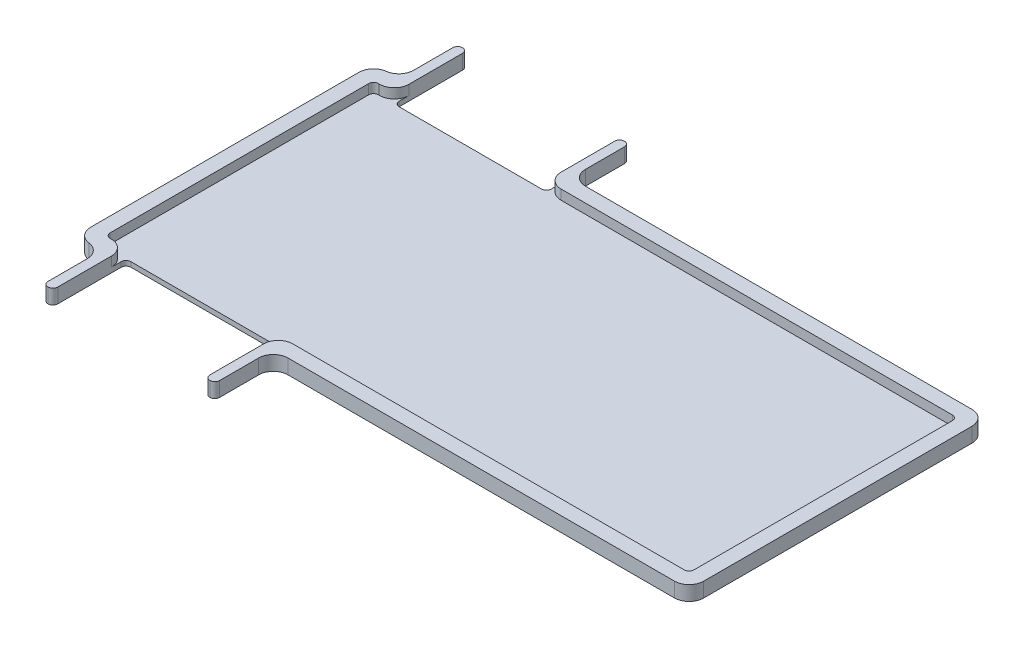
from build123d import *

# Parameters (mm, degrees)
BOSS_EXTRUDE6_DEPTH   = 3
BOSS_EXTRUDE6_2_DEPTH = 3
SKETCH4_W             = 119.7
SKETCH4_H             = 55
BOSS_EXTRUDE7_DEPTH   = 1
FILLET13_R            = 3
FILLET14_R            = 1
FILLET15_R            = 1
FILLET16_R            = 3
FILLET17_R            = 3
FILLET18_R            = 1
FILLET19_R            = 3
FILLET20_R            = 1


with BuildPart() as part:
    # Sketch3 → Boss-Extrude6 (new body)
    with BuildSketch(Plane(origin=(0, 0, 0), x_dir=(1, 0, 0), z_dir=(0, 1, 0))):
        Polygon((-55.6, -27.5), (-59.85, -27.5), (-59.85, 27.5), (-55.6, 27.5), (-55.6, 42.5), (-57.6, 42.5), (-57.6, 30.5), (-62.85, 30.5), (-62.85, -30.5), (-57.6, -30.5), (-57.6, -42.5), (-55.6, -42.5), align=None)
    extrude(amount=BOSS_EXTRUDE6_DEPTH)



with BuildPart() as body_2:
    # Sketch3 → Boss-Extrude6 2 (new body)
    with BuildSketch(Plane(origin=(0, 0, 0), x_dir=(1, 0, 0), z_dir=(0, 1, 0))):
        Polygon((59.85, -27.5), (-24.4, -27.5), (-24.4, -42.5), (-22.4, -42.5), (-22.4, -30.5), (62.85, -30.5), (62.85, 30.5), (-22.4, 30.5), (-22.4, 42.5), (-24.4, 42.5), (-24.4, 27.5), (59.85, 27.5), align=None)
    extrude(amount=BOSS_EXTRUDE6_2_DEPTH)


with BuildPart() as part_1:
    add(part.part)

    add(body_2.part)  # Boss-Extrude7 merges body 2
    # Sketch4 → Boss-Extrude7 (add)
    with BuildSketch(Plane(origin=(0, 0, 0), x_dir=(1, 0, 0), z_dir=(0, 1, 0))):
        Rectangle(SKETCH4_W, SKETCH4_H)
    extrude(amount=BOSS_EXTRUDE7_DEPTH)

    # Fillet13
    fillet13_edges = [part_1.edges().sort_by_distance(p)[0] for p in [
        (-62.85, 1.5, 30.5),
        (-62.85, 1.5, -30.5),
        (62.85, 1.5, 30.5),
        (62.85, 1.5, -30.5),
    ]]
    fillet(fillet13_edges, radius=FILLET13_R)

    # Fillet14
    fillet14_edges = [part_1.edges().sort_by_distance(p)[0] for p in [
        (-59.85, 2, -27.5),
        (-59.85, 2, 27.5),
        (59.85, 2, -27.5),
        (59.85, 2, 27.5),
    ]]
    fillet(fillet14_edges, radius=FILLET14_R)

    # Fillet15
    fillet15_edges = [part_1.edges().sort_by_distance(p)[0] for p in [
        (-22.4, 1.5, 42.5),
        (-24.4, 1.5, 42.5),
        (-55.6, 1.5, 42.5),
        (-57.6, 1.5, 42.5),
        (-55.6, 1.5, -42.5),
        (-57.6, 1.5, -42.5),
        (-22.4, 1.5, -42.5),
        (-24.4, 1.5, -42.5),
    ]]
    fillet(fillet15_edges, radius=FILLET15_R - 0.0001)  # a hair under: the kernel refuses the full size

    # Fillet16
    fillet16_edges = [part_1.edges().sort_by_distance(p)[0] for p in [
        (-22.4, 1.5, -30.5),
        (-57.6, 1.5, -30.5),
        (-57.6, 1.5, 30.5),
        (-22.4, 1.5, 30.5),
    ]]
    fillet(fillet16_edges, radius=FILLET16_R)

    # Fillet17
    fillet17_edges = [part_1.edges().sort_by_distance(p)[0] for p in [
        (-55.6, 2, -27.5),
        (-24.4, 2, -27.5),
    ]]
    fillet(fillet17_edges, radius=FILLET17_R)

    # Fillet18
    fillet18_edges = [part_1.edges().sort_by_distance(p)[0] for p in [
        (-55.6, 0.5, -27.5),
        (-24.4, 0.5, -27.5),
    ]]
    fillet(fillet18_edges, radius=FILLET18_R)

    # Fillet19
    fillet19_edges = [part_1.edges().sort_by_distance(p)[0] for p in [
        (-55.6, 2, 27.5),
        (-24.4, 2, 27.5),
    ]]
    fillet(fillet19_edges, radius=FILLET19_R)

    # Fillet20
    fillet20_edges = [part_1.edges().sort_by_distance(p)[0] for p in [
        (-55.6, 0.5, 27.5),
        (-24.4, 0.5, 27.5),
    ]]
    fillet(fillet20_edges, radius=FILLET20_R)


solid = part_1.part
